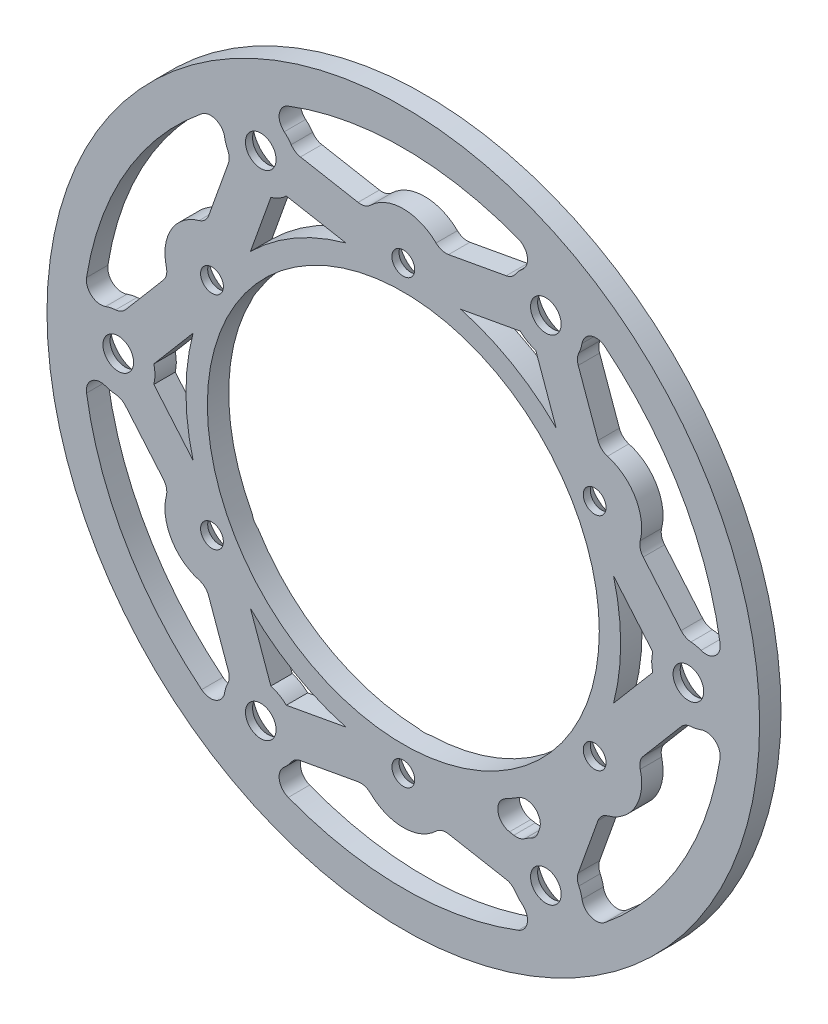
from build123d import *

# Parameters (mm, degrees)
SKETCH_1_R               = 50
EXTRUDE_2_DEPTH          = 3
SKETCH_2_R               = 27.5
CUT_EXTRUDE_1_DEPTH      = 4
SKETCH_3_R               = 1.6
CUT_EXTRUDE_2_DEPTH      = 4
CHAMFER_1_SIZE           = 2
SKETCH_4_R               = 2.15
CUT_EXTRUDE_3_DEPTH      = 71.774289121
PATTERN_CIRCULAR_1_COUNT = 6
CUT_EXTRUDE_4_DEPTH      = 71.774289121
CUT_EXTRUDE_4_DEPTH_BACK = 71.774289121
FILLET_3_R               = 2
CHAMFER_2_SIZE           = 2


with BuildPart() as part:
    # 草图1 → 凸台-拉伸2 (new body)
    with BuildSketch(Plane.XY):
        Circle(SKETCH_1_R)
    extrude(amount=EXTRUDE_2_DEPTH)

    # 草图2 → 切除-拉伸1 (cut)
    with BuildSketch(Plane.XY.offset(3)):
        Circle(SKETCH_2_R)
    extrude(amount=-CUT_EXTRUDE_1_DEPTH, mode=Mode.SUBTRACT)

    # 草图3 → 切除-拉伸2 (cut)
    with BuildSketch(Plane.XY.offset(3)):
        with Locations((0, 31)):
            Circle(SKETCH_3_R)
        with Locations((26.846787517, 15.5)):
            Circle(SKETCH_3_R)
        with Locations((26.846787517, -15.5)):
            Circle(SKETCH_3_R)
        with Locations((0, -31)):
            Circle(SKETCH_3_R)
        with Locations((-26.846787517, -15.5)):
            Circle(SKETCH_3_R)
        with Locations((-26.846787517, 15.5)):
            Circle(SKETCH_3_R)
    extrude(amount=-CUT_EXTRUDE_2_DEPTH, mode=Mode.SUBTRACT)

    # 倒角1
    # the kernel refuses this chamfer: 2 mm, written as the material it takes off along each edge
    with BuildSketch(Plane(origin=(0, 31, 0), x_dir=(1, 0, 0), z_dir=(0, -1, 0))) as chamfer_1_piece_1:
        Polygon((1.6 + CHAMFER_1_SIZE, 0), (1.6, CHAMFER_1_SIZE), (1.6, 0), align=None)
    revolve(axis=Axis((0, 31, 0), (0, 0, 1)), mode=Mode.SUBTRACT)
    with BuildSketch(Plane(origin=(-26.846787517, 15.5, 0), x_dir=(1, 0, 0), z_dir=(0, -1, 0))) as chamfer_1_piece_2:
        Polygon((1.6 + CHAMFER_1_SIZE, 0), (1.6, CHAMFER_1_SIZE), (1.6, 0), align=None)
    revolve(axis=Axis((-26.846787517, 15.5, 0), (0, 0, 1)), mode=Mode.SUBTRACT)
    with BuildSketch(Plane(origin=(-26.846787517, -15.5, 0), x_dir=(1, 0, 0), z_dir=(0, -1, 0))) as chamfer_1_piece_3:
        Polygon((1.6 + CHAMFER_1_SIZE, 0), (1.6, CHAMFER_1_SIZE), (1.6, 0), align=None)
    revolve(axis=Axis((-26.846787517, -15.5, 0), (0, 0, 1)), mode=Mode.SUBTRACT)
    with BuildSketch(Plane(origin=(0, -31, 0), x_dir=(1, 0, 0), z_dir=(0, -1, 0))) as chamfer_1_piece_4:
        Polygon((1.6 + CHAMFER_1_SIZE, 0), (1.6, CHAMFER_1_SIZE), (1.6, 0), align=None)
    revolve(axis=Axis((0, -31, 0), (0, 0, 1)), mode=Mode.SUBTRACT)
    with BuildSketch(Plane(origin=(26.846787517, -15.5, 0), x_dir=(1, 0, 0), z_dir=(0, -1, 0))) as chamfer_1_piece_5:
        Polygon((1.6 + CHAMFER_1_SIZE, 0), (1.6, CHAMFER_1_SIZE), (1.6, 0), align=None)
    revolve(axis=Axis((26.846787517, -15.5, 0), (0, 0, 1)), mode=Mode.SUBTRACT)
    with BuildSketch(Plane(origin=(26.846787517, 15.5, 0), x_dir=(1, 0, 0), z_dir=(0, -1, 0))) as chamfer_1_piece_6:
        Polygon((1.6 + CHAMFER_1_SIZE, 0), (1.6, CHAMFER_1_SIZE), (1.6, 0), align=None)
    revolve(axis=Axis((26.846787517, 15.5, 0), (0, 0, 1)), mode=Mode.SUBTRACT)

    # 草图4 → 切除-拉伸3 (cut, symmetric)
    with BuildSketch(Plane(origin=(0, 0, 0), x_dir=(-1, 0, 0), z_dir=(0, 0, -1))):
        with Locations((20, 34.641016151)):
            Circle(SKETCH_4_R)
    cut_extrude_3 = extrude(amount=CUT_EXTRUDE_3_DEPTH, both=True, mode=Mode.SUBTRACT)

    # 阵列(圆周)1: 切除-拉伸3 ×6 about axis
    pattern_circular_1_axis = Axis((0, 0, 0), (0, 0, 1))
    for i in range(1, PATTERN_CIRCULAR_1_COUNT):
        add(cut_extrude_3.rotate(pattern_circular_1_axis, i * 360 / PATTERN_CIRCULAR_1_COUNT), mode=Mode.SUBTRACT)

    # 草图5 → 切除-拉伸4 (cut, two sides: drawn at the far end of the back side and taken through both)
    with BuildSketch(Plane(origin=(0, 0, 0), x_dir=(-1, 0, 0), z_dir=(0, 0, -1)).offset(-CUT_EXTRUDE_4_DEPTH_BACK)):
        with BuildLine():
            ThreePointArc((25.15, -34.641016151), (24.753152572, -36.623449159), (23.623770629, -38.3003585))
            ThreePointArc((23.623770629, -38.3003585), (38.97114317, -22.5), (44.98096875, -1.308606248))
            ThreePointArc((44.98096875, -1.308606248), (42.975613658, -4.203358581), (39.578960448, -5.132760047))
            Line((39.578960448, -5.132760047), (32.937911824, -12.958700197))
            ThreePointArc((32.937911824, -12.958700197), (32.562555182, -18.8), (27.691519483, -22.045718288))
            Line((27.691519483, -22.045718288), (24.234580816, -31.71000518))
            ThreePointArc((24.234580816, -31.71000518), (24.915820949, -33.105697162), (25.15, -34.641016151))
        make_face()
        with BuildLine():
            Line((29.503479206, -7.732704234), (35.004152785, -1.250604094))
            ThreePointArc((35.004152785, -1.250604094), (34.85, 0), (35.004152785, 1.250604094))
            Line((35.004152785, 1.250604094), (29.503479206, 7.732704234))
            ThreePointArc((29.503479206, 7.732704234), (30.249843932, 3.898325553), (30.5, 0))
            ThreePointArc((30.5, 0), (30.249843932, -3.898325553), (29.503479206, -7.732704234))
        make_face()
        with BuildLine():
            ThreePointArc((44.98096875, 1.308606248), (38.97114317, 22.5), (23.623770629, 38.3003585))
            ThreePointArc((23.623770629, 38.3003585), (24.753152572, 36.623449159), (25.15, 34.641016151))
            ThreePointArc((25.15, 34.641016151), (24.915820949, 33.105697162), (24.234580816, 31.71000518))
            Line((24.234580816, 31.71000518), (27.691519483, 22.045718288))
            ThreePointArc((27.691519483, 22.045718288), (32.562555182, 18.8), (32.937911824, 12.958700197))
            Line((32.937911824, 12.958700197), (39.578960448, 5.132760047))
            ThreePointArc((39.578960448, 5.132760047), (42.975613658, 4.203358581), (44.98096875, 1.308606248))
        make_face()
        with BuildLine():
            ThreePointArc((18.585131308, 29.689183502), (17.425, 30.180985322), (16.419021477, 30.939787596))
            Line((16.419021477, 30.939787596), (8.055021296, 29.417114609))
            ThreePointArc((8.055021296, 29.417114609), (15.25, 26.413774815), (21.448457909, 21.684410375))
            Line((21.448457909, 21.684410375), (18.585131308, 29.689183502))
        make_face()
        with BuildLine():
            ThreePointArc((21.357198121, 39.608964748), (0, 45), (-21.357198121, 39.608964748))
            ThreePointArc((-21.357198121, 39.608964748), (-17.847591517, 39.319652461), (-15.344379632, 36.842765227))
            Line((-15.344379632, 36.842765227), (-5.246392341, 35.004418486))
            ThreePointArc((-5.246392341, 35.004418486), (0, 37.6), (5.246392341, 35.004418486))
            Line((5.246392341, 35.004418486), (15.344379632, 36.842765227))
            ThreePointArc((15.344379632, 36.842765227), (17.847591517, 39.319652461), (21.357198121, 39.608964748))
        make_face()
        with BuildLine():
            ThreePointArc((-44.98096875, 1.308606248), (-42.975613658, 4.203358581), (-39.578960448, 5.132760047))
            Line((-39.578960448, 5.132760047), (-32.937911824, 12.958700197))
            ThreePointArc((-32.937911824, 12.958700197), (-32.562555182, 18.8), (-27.691519483, 22.045718288))
            Line((-27.691519483, 22.045718288), (-24.234580816, 31.71000518))
            ThreePointArc((-24.234580816, 31.71000518), (-25.128022141, 35.116293881), (-23.623770629, 38.3003585))
            ThreePointArc((-23.623770629, 38.3003585), (-38.97114317, 22.5), (-44.98096875, 1.308606248))
        make_face()
        with BuildLine():
            ThreePointArc((-16.419021477, 30.939787596), (-17.425, 30.180985322), (-18.585131308, 29.689183502))
            Line((-18.585131308, 29.689183502), (-21.448457909, 21.684410375))
            ThreePointArc((-21.448457909, 21.684410375), (-15.25, 26.413774815), (-8.055021296, 29.417114609))
            Line((-8.055021296, 29.417114609), (-16.419021477, 30.939787596))
        make_face()
        with BuildLine():
            ThreePointArc((-34.85, 0), (-34.888683479, -0.630034459), (-35.004152785, -1.250604094))
            Line((-35.004152785, -1.250604094), (-29.503479206, -7.732704234))
            ThreePointArc((-29.503479206, -7.732704234), (-30.5, 0), (-29.503479206, 7.732704234))
            Line((-29.503479206, 7.732704234), (-35.004152785, 1.250604094))
            ThreePointArc((-35.004152785, 1.250604094), (-34.888683479, 0.630034459), (-34.85, 0))
        make_face()
        with BuildLine():
            ThreePointArc((-27.691519483, -22.045718288), (-32.562555182, -18.8), (-32.937911824, -12.958700197))
            Line((-32.937911824, -12.958700197), (-39.578960448, -5.132760047))
            ThreePointArc((-39.578960448, -5.132760047), (-42.975613658, -4.203358581), (-44.98096875, -1.308606248))
            ThreePointArc((-44.98096875, -1.308606248), (-38.97114317, -22.5), (-23.623770629, -38.3003585))
            ThreePointArc((-23.623770629, -38.3003585), (-25.128022141, -35.116293881), (-24.234580816, -31.71000518))
            Line((-24.234580816, -31.71000518), (-27.691519483, -22.045718288))
        make_face()
        with BuildLine():
            Line((-21.448457909, -21.684410375), (-18.585131308, -29.689183502))
            ThreePointArc((-18.585131308, -29.689183502), (-17.425, -30.180985322), (-16.419021477, -30.939787596))
            Line((-16.419021477, -30.939787596), (-8.055021296, -29.417114609))
            ThreePointArc((-8.055021296, -29.417114609), (-15.25, -26.413774815), (-21.448457909, -21.684410375))
        make_face()
        with BuildLine():
            Line((-5.246392341, -35.004418486), (-15.344379632, -36.842765227))
            ThreePointArc((-15.344379632, -36.842765227), (-17.847591517, -39.319652461), (-21.357198121, -39.608964748))
            ThreePointArc((-21.357198121, -39.608964748), (0, -45), (21.357198121, -39.608964748))
            ThreePointArc((21.357198121, -39.608964748), (17.847591517, -39.319652461), (15.344379632, -36.842765227))
            Line((15.344379632, -36.842765227), (5.246392341, -35.004418486))
            ThreePointArc((5.246392341, -35.004418486), (0, -37.6), (-5.246392341, -35.004418486))
        make_face()
        with BuildLine():
            Line((8.055021296, -29.417114609), (16.419021477, -30.939787596))
            ThreePointArc((16.419021477, -30.939787596), (17.425, -30.180985322), (18.585131308, -29.689183502))
            Line((18.585131308, -29.689183502), (21.448457909, -21.684410375))
            ThreePointArc((21.448457909, -21.684410375), (15.25, -26.413774815), (8.055021296, -29.417114609))
        make_face()
    extrude(amount=CUT_EXTRUDE_4_DEPTH + CUT_EXTRUDE_4_DEPTH_BACK, mode=Mode.SUBTRACT)

    # 圆角3
    fillet_3_edges = [part.edges().sort_by_distance(p)[0] for p in [
        (23.623770629, 38.3003585, 1.5),
        (24.234580816, 31.71000518, 1.5),
        (27.691519483, 22.045718288, 1.5),
        (32.937911824, 12.958700197, 1.5),
        (39.578960448, 5.132760047, 1.5),
        (44.98096875, 1.308606248, 1.5),
        (44.98096875, -1.308606248, 1.5),
        (39.578960448, -5.132760047, 1.5),
        (32.937911824, -12.958700197, 1.5),
        (27.691519483, -22.045718288, 1.5),
        (24.234580816, -31.71000518, 1.5),
        (23.623770629, -38.3003585, 1.5),
        (-21.357198121, 39.608964748, 1.5),
        (-15.344379632, 36.842765227, 1.5),
        (-5.246392341, 35.004418486, 1.5),
        (5.246392341, 35.004418486, 1.5),
        (15.344379632, 36.842765227, 1.5),
        (21.357198121, 39.608964748, 1.5),
        (-44.98096875, 1.308606248, 1.5),
        (-39.578960448, 5.132760047, 1.5),
        (-32.937911824, 12.958700197, 1.5),
        (-27.691519483, 22.045718288, 1.5),
        (-24.234580816, 31.71000518, 1.5),
        (-23.623770629, 38.3003585, 1.5),
        (21.357198121, -39.608964748, 1.5),
        (15.344379632, -36.842765227, 1.5),
        (5.246392341, -35.004418486, 1.5),
        (-5.246392341, -35.004418486, 1.5),
        (-15.344379632, -36.842765227, 1.5),
        (-21.357198121, -39.608964748, 1.5),
        (21.448457909, -21.684410375, 1.5),
        (8.055021296, -29.417114609, 1.5),
        (16.419021477, -30.939787596, 1.5),
        (18.585131308, -29.689183502, 1.5),
        (-23.623770629, -38.3003585, 1.5),
        (-24.234580816, -31.71000518, 1.5),
        (-27.691519483, -22.045718288, 1.5),
        (-32.937911824, -12.958700197, 1.5),
        (-39.578960448, -5.132760047, 1.5),
        (-44.98096875, -1.308606248, 1.5),
    ]]
    fillet(fillet_3_edges, radius=FILLET_3_R)

    # 倒角2
    chamfer_2_edges = [part.edges().sort_by_distance(p)[0] for p in [
        (-17.85, 34.641016151, 0),
        (-38.925, 1.861954618, 0),
        (-21.075, -32.779061533, 0),
        (17.85, -34.641016151, 0),
        (38.925, -1.861954618, 0),
        (21.075, 32.779061533, 0),
    ]]
    chamfer(chamfer_2_edges, length=CHAMFER_2_SIZE)


solid = part.part
